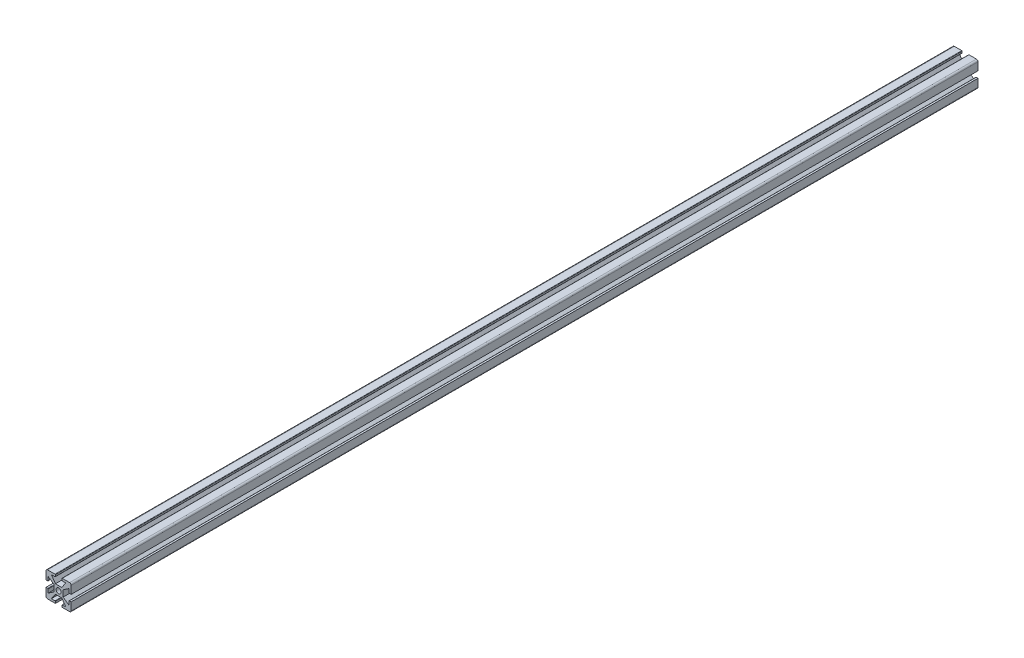
from build123d import *

# Parameters (mm, degrees)
SKETCH1_W           = 25.4
SKETCH1_H           = 25.4
BOSS_EXTRUDE1_DEPTH = 914.4
FILLET1_R           = 1.5875
HOLE1_OUTLINE_R     = 2.5527
HOLE1_DEPTH         = 914.4
SKETCH7_W           = 6.5278
SKETCH7_H           = 2.2352
CUT_EXTRUDE2_DEPTH  = 914.4
FILLET4_R           = 0.396875
CIRPATTERN2_DEPTH   = 914.4


# Read off the part's stored shape, not the designer's step: Hole1, CirPattern2
with BuildPart() as part:
    # Sketch1 → Boss-Extrude1 (new body)
    with BuildSketch(Plane.XY):
        Rectangle(SKETCH1_W, SKETCH1_H)
    extrude(amount=BOSS_EXTRUDE1_DEPTH)

    # Fillet1
    fillet1_edges = [part.edges().sort_by_distance(p)[0] for p in [
        (12.7, -12.7, 457.2),
        (-12.7, -12.7, 457.2),
        (-12.7, 12.7, 457.2),
        (12.7, 12.7, 457.2),
    ]]
    fillet(fillet1_edges, radius=FILLET1_R)

    # Hole1 outline → Hole1 (cut)
    with BuildSketch(Plane.XY):
        with Locations((0, -0.048792482)):
            Circle(HOLE1_OUTLINE_R)
    extrude(amount=HOLE1_DEPTH, mode=Mode.SUBTRACT)

    # Sketch7 → Cut-Extrude2 (cut)
    with BuildSketch(Plane.XY.offset(914.4)):
        with Locations((0, 11.5824)):
            Rectangle(SKETCH7_W, SKETCH7_H)
        Polygon((-3.175, 4.5212), (-7.3025, 10.4648), (7.3025, 10.4648), (3.175, 4.5212), align=None)
    extrude(amount=-CUT_EXTRUDE2_DEPTH, mode=Mode.SUBTRACT)

    # Fillet4
    fillet4_edges = [part.edges().sort_by_distance(p)[0] for p in [
        (-3.2639, 10.4648, 457.2),
        (-3.2639, 12.7, 457.2),
        (3.2639, 12.7, 457.2),
        (3.2639, 10.4648, 457.2),
    ]]
    fillet(fillet4_edges, radius=FILLET4_R)

    # CirPattern2 outline → CirPattern2 (cut)
    with BuildSketch(Plane.XY):
        with BuildLine():
            ThreePointArc((-3.660775, -10.562384964), (-3.380141996, -10.67862696), (-3.2639, -10.959259964))
            Line((-3.2639, -10.959259964), (-3.2639, -12.7))
            Line((-3.2639, -12.7), (3.2639, -12.7))
            Line((3.2639, -12.7), (3.2639, -10.959259964))
            ThreePointArc((3.2639, -10.959259964), (3.380141996, -10.67862696), (3.660775, -10.562384964))
            Line((3.660775, -10.562384964), (7.3025, -10.562384964))
            Line((7.3025, -10.562384964), (3.175, -4.618784964))
            Line((3.175, -4.618784964), (-3.175, -4.618784964))
            Line((-3.175, -4.618784964), (-7.3025, -10.562384964))
            Line((-7.3025, -10.562384964), (-3.660775, -10.562384964))
        make_face()
        with BuildLine():
            Line((-12.7, -3.312692482), (-10.910467482, -3.312692482))
            ThreePointArc((-10.910467482, -3.312692482), (-10.629834478, -3.428934478), (-10.513592482, -3.709567482))
            Line((-10.513592482, -3.709567482), (-10.513592482, -7.351292482))
            Line((-10.513592482, -7.351292482), (-4.569992482, -3.223792482))
            Line((-4.569992482, -3.223792482), (-4.569992482, 3.126207518))
            Line((-4.569992482, 3.126207518), (-10.513592482, 7.253707518))
            Line((-10.513592482, 7.253707518), (-10.513592482, 3.611982518))
            ThreePointArc((-10.513592482, 3.611982518), (-10.629834478, 3.331349514), (-10.910467482, 3.215107518))
            Line((-10.910467482, 3.215107518), (-12.7, 3.215107518))
            Line((-12.7, 3.215107518), (-12.7, -3.312692482))
        make_face()
        with BuildLine():
            ThreePointArc((10.513592482, -3.709567482), (10.629834478, -3.428934478), (10.910467482, -3.312692482))
            Line((10.910467482, -3.312692482), (12.7, -3.312692482))
            Line((12.7, -3.312692482), (12.7, 3.215107518))
            Line((12.7, 3.215107518), (10.910467482, 3.215107518))
            ThreePointArc((10.910467482, 3.215107518), (10.629834478, 3.331349514), (10.513592482, 3.611982518))
            Line((10.513592482, 3.611982518), (10.513592482, 7.253707518))
            Line((10.513592482, 7.253707518), (4.569992482, 3.126207518))
            Line((4.569992482, 3.126207518), (4.569992482, -3.223792482))
            Line((4.569992482, -3.223792482), (10.513592482, -7.351292482))
            Line((10.513592482, -7.351292482), (10.513592482, -3.709567482))
        make_face()
    extrude(amount=CIRPATTERN2_DEPTH, mode=Mode.SUBTRACT)


solid = part.part
